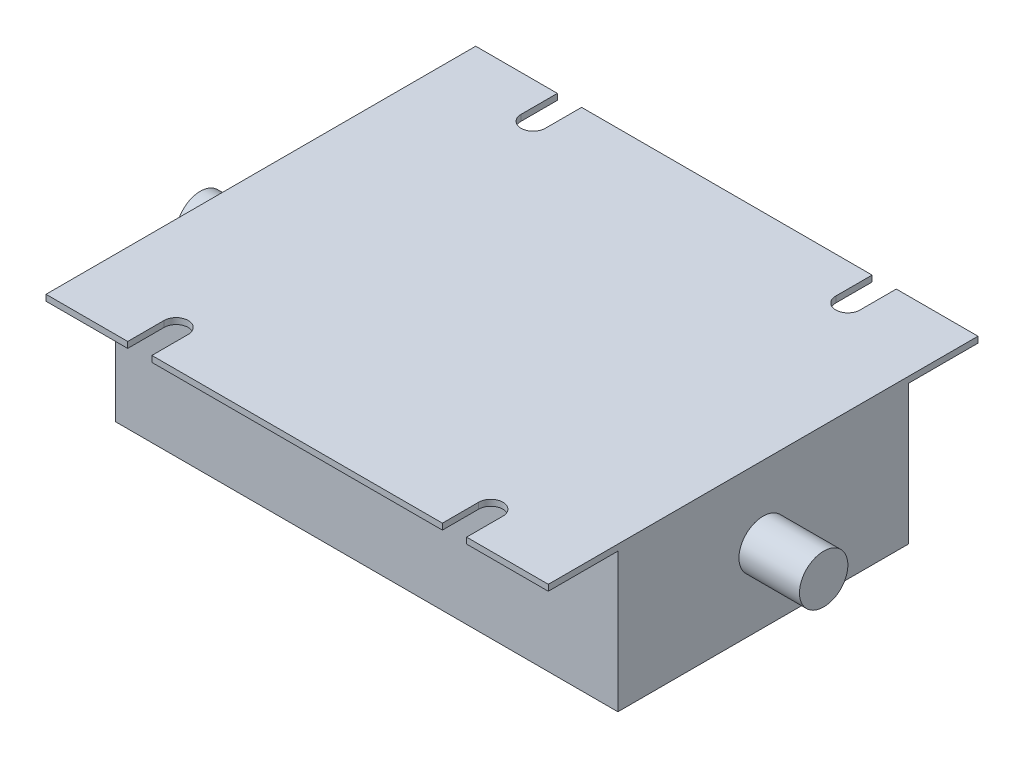
from build123d import *

# Parameters (mm, degrees)
SKETCH_1_W            = 83
SKETCH_1_H            = 48
EXTRUDE_1_DEPTH       = 24
SKETCH_21_W           = 83
SKETCH_21_H           = 1
EXTRUDE_2_DEPTH       = 35.5
CUT_EXTRUDE_20_DEPTH  = 60.653164208
MIRROR_2_COPY_1_DEPTH = 60.653164208
MIRROR_2_COPY_2_DEPTH = 60.653164208
SKETCH_27_R           = 4
EXTRUDE_4_DEPTH       = 10


with BuildPart() as part:
    # 草圖1 → 填料-伸長1 (new body)
    with BuildSketch(Plane(origin=(0, 18, 0), x_dir=(1, 0, 0), z_dir=(0, 1, 0))):
        Rectangle(SKETCH_1_W, SKETCH_1_H)
    extrude(amount=-EXTRUDE_1_DEPTH)

    # 草圖21 → 填料-伸長2 (add, symmetric)
    with BuildSketch(Plane(origin=(0, 0, 0), x_dir=(-1, 0, 0), z_dir=(0, 0, -1))):
        with Locations((0, 17.5)):
            Rectangle(SKETCH_21_W, SKETCH_21_H)
    extrude(amount=EXTRUDE_2_DEPTH, both=True)

    # 草圖22 → 除料-伸長20 (cut, through all)
    with BuildSketch(Plane(origin=(0, 18, 0), x_dir=(-1, 0, 0), z_dir=(0, 1, 0))):
        with BuildLine():
            Line((-28, -29.5), (-28, -35.5))
            Line((-28, -35.5), (-24, -35.5))
            Line((-24, -35.5), (-24, -29.5))
            ThreePointArc((-24, -29.5), (-26, -27.5), (-28, -29.5))
        make_face()
    cut_extrude_20 = extrude(amount=-CUT_EXTRUDE_20_DEPTH, mode=Mode.SUBTRACT)

    # 鏡射1: 除料-伸長20 across plane
    add(cut_extrude_20.mirror(Plane(origin=(0, 0, 0), x_dir=(0, 0, 1), z_dir=(1, 0, 0))), mode=Mode.SUBTRACT)

    # 鏡射2 copy 1 sketch → 鏡射2 copy 1 (cut, through all)
    with BuildSketch(Plane(origin=(0, 18, 0), x_dir=(1, 0, 0), z_dir=(0, 1, 0))):
        with BuildLine():
            Line((-28, -29.5), (-28, -35.5))
            Line((-28, -35.5), (-24, -35.5))
            Line((-24, -35.5), (-24, -29.5))
            ThreePointArc((-24, -29.5), (-26, -27.5), (-28, -29.5))
        make_face()
    extrude(amount=-MIRROR_2_COPY_1_DEPTH, mode=Mode.SUBTRACT)

    # 鏡射2 copy 2 sketch → 鏡射2 copy 2 (cut, through all)
    with BuildSketch(Plane(origin=(0, 18, 0), x_dir=(-1, 0, 0), z_dir=(0, 1, 0))):
        with BuildLine():
            Line((-28, 29.5), (-28, 35.5))
            Line((-28, 35.5), (-24, 35.5))
            Line((-24, 35.5), (-24, 29.5))
            ThreePointArc((-24, 29.5), (-26, 27.5), (-28, 29.5))
        make_face()
    extrude(amount=-MIRROR_2_COPY_2_DEPTH, mode=Mode.SUBTRACT)

    # 草圖27 → 填料-伸長4 (add)
    with BuildSketch(Plane.ZY.offset(41.5)):
        with Locations((0, 6)):
            Circle(SKETCH_27_R)
    extrude_4 = extrude(amount=EXTRUDE_4_DEPTH)

    # 鏡射3: 填料-伸長4 across plane
    add(extrude_4.mirror(Plane(origin=(0, 0, 0), x_dir=(0, 0, 1), z_dir=(1, 0, 0))))


solid = part.part
